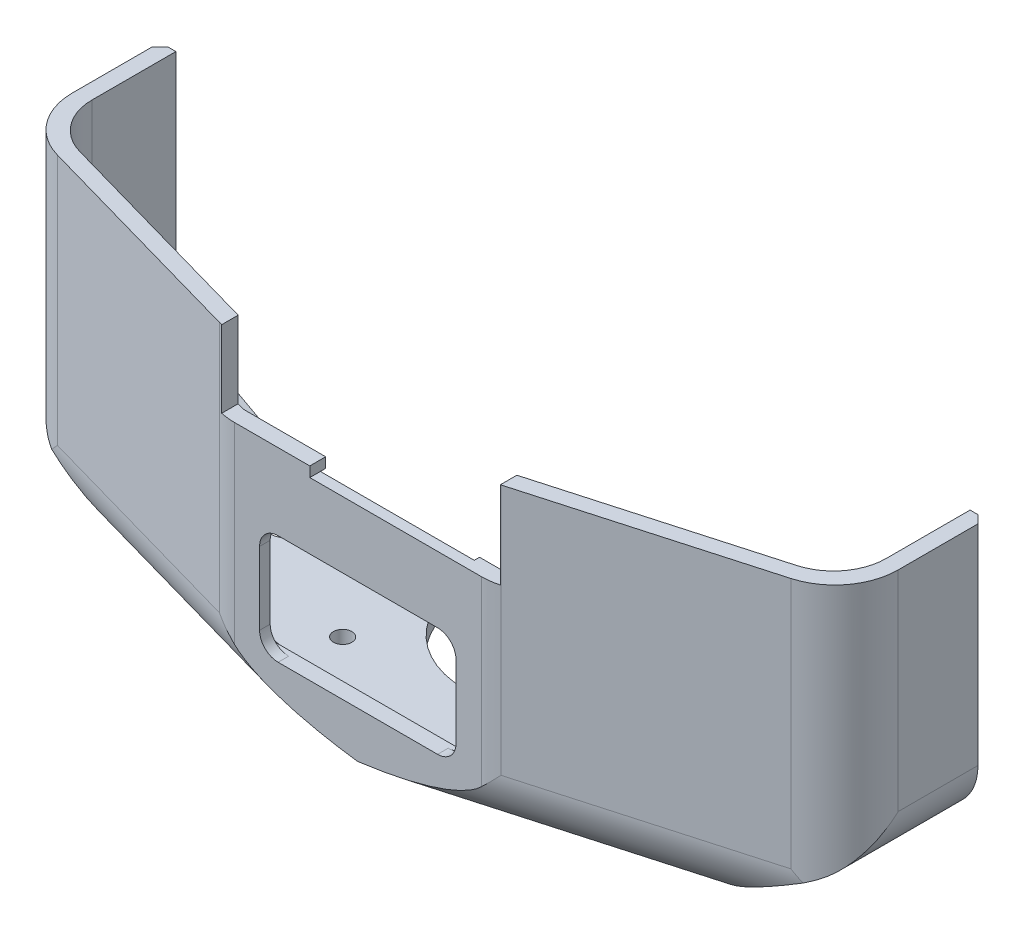
from build123d import *

# Parameters (mm, degrees)
BOSS_EXTRUDE1_DEPTH      = 30
BOSS_EXTRUDE1_DEPTH_BACK = 10.64
CUT_EXTRUDE1_DEPTH       = 103.587767302
SHELL1_T                 = -3
CUT_EXTRUDE4_DEPTH       = 4
CUT_EXTRUDE4_DEPTH_BACK  = 10
FILLET1_R                = 12
SKETCH4_R                = 1.75
CUT_EXTRUDE2_DEPTH       = 30
BOSS_EXTRUDE2_REACH      = 102.877
FILLET2_R                = 10
CUT_EXTRUDE5_DEPTH       = 3
CUT_EXTRUDE6_DEPTH       = 10
CUT_EXTRUDE8_REACH       = 99.307
SKETCH16_W               = 37.1
SKETCH16_H               = 20.7
FILLET3_SIZE             = 3.48
FILLET3_SIZE_2           = 3.5
CUT_EXTRUDE10_REACH      = 99.181
SKETCH17_W               = 40
SKETCH17_H               = 1
CUT_EXTRUDE13_DEPTH      = 10
CUT_EXTRUDE14_DEPTH      = 10
CHAMFER1_SIZE            = 1.5
SKETCH23_W               = 44.119126033
SKETCH23_H               = 4.214364277
BOSS_EXTRUDE3_DEPTH      = 3
CHAMFER2_START           = 18.419384615
CHAMFER2_DEPTH           = 4.277963528
CHAMFER2_START_2         = -21.42177789
CHAMFER2_2_DEPTH         = 2.918085582
CHAMFER2_3_DEPTH         = 44.119126033
CHAMFER2_START_3         = -18.503692308
CHAMFER2_4_DEPTH         = 3.433692208
CHAMFER2_START_4         = 15.0499999
CHAMFER2_5_DEPTH         = 3.369384715
CHAMFER2_START_5         = 27.133974371
CHAMFER2_6_DEPTH         = 0.866025629


with BuildPart() as part:
    # Sketch1 → Boss-Extrude1 (new, two sides: drawn at the far end of the back side and taken through both)
    with BuildSketch(Plane.XY.offset(-BOSS_EXTRUDE1_DEPTH_BACK)):
        Polygon((-52, -41.630628171), (52, -41.630628171), (78, -27.630628171), (78, 17.869371829), (-78, 17.869371829), (-78, -27.630628171), align=None)
    extrude(amount=BOSS_EXTRUDE1_DEPTH + BOSS_EXTRUDE1_DEPTH_BACK)

    # Sketch2 → Cut-Extrude1 (cut, through all)
    with BuildSketch(Plane(origin=(0, 17.869371829, 0), x_dir=(1, 0, 0), z_dir=(0, 1, 0))):
        Polygon((-78, -15), (-25, -30), (25, -30), (78, -15), (78, -44.649515781), (-78, -44.649515781), align=None)
    extrude(amount=-CUT_EXTRUDE1_DEPTH, mode=Mode.SUBTRACT)

    # Shell1
    shell1_openings = [part.faces().sort_by_distance(p)[0] for p in [
        (0, -10.856818648, -10.64),
    ]]
    offset(amount=SHELL1_T, openings=shell1_openings, kind=Kind.INTERSECTION)

    # Sketch7 → Cut-Extrude4 (cut, two sides: drawn at the far end of the back side and taken through both)
    with BuildSketch(Plane.XZ.offset(-14.869371829).offset(-CUT_EXTRUDE4_DEPTH_BACK)):
        with BuildLine():
            Line((-24.34, 27.068957127), (24.34, 27.068957127))
            Line((24.34, 27.068957127), (67.723224658, 14.790685998))
            ThreePointArc((67.723224658, 14.790685998), (72.97597162, 11.200530439), (75, 5.16862554))
            Line((75, 5.16862554), (75, -10.64))
            Line((75, -10.64), (-75, -10.64))
            Line((-75, -10.64), (-75, 5.168629683))
            ThreePointArc((-75, 5.168629683), (-72.975970371, 11.200532091), (-67.723224658, 14.790685998))
            Line((-67.723224658, 14.790685998), (-24.34, 27.068957127))
        make_face()
    extrude(amount=CUT_EXTRUDE4_DEPTH + CUT_EXTRUDE4_DEPTH_BACK, mode=Mode.SUBTRACT)

    # Fillet1
    # the kernel refuses this fillet: 12 mm, written as the material it adds along each edge
    with BuildSketch(Plane(origin=(-80.109828635, -38.630628171, 11.285043363), x_dir=(0.2723224657993489, 0, -0.9622060458243662), z_dir=(0.9622060458243663, 0, 0.27232246579934893))) as fillet1_piece_1_section:
        with BuildLine():
            CenterArc((FILLET1_R, FILLET1_R), FILLET1_R, 180, 90)
            Line((0, FILLET1_R), (0, 0))
            Line((0, 0), (FILLET1_R, 0))
        make_face()
    fillet1_piece_1 = extrude(amount=108.707161952, mode=Mode.PRIVATE)
    fillet1_piece_1 = split(fillet1_piece_1, bisect_by=Plane(origin=(-73.621558509, -26.580983653, 11.285043363), z_dir=(0.47409982303501746, 0.8804710999221753, 0)), keep=Keep.TOP, mode=Mode.PRIVATE)
    fillet1_piece_1 = split(fillet1_piece_1, bisect_by=Plane(origin=(-80.109828635, -38.630628171, 27), z_dir=(0, 0, -1)), keep=Keep.TOP, mode=Mode.PRIVATE)
    add(fillet1_piece_1)
    with BuildSketch(Plane(origin=(-24.48885982, -38.630628171, 40.888445756), x_dir=(-0.272322465799349, 0, -0.9622060458243663), z_dir=(0.9622060458243663, 0, -0.27232246579934893))) as fillet1_piece_2_section:
        with BuildLine():
            CenterArc((FILLET1_R, FILLET1_R), FILLET1_R, 180, 90)
            Line((0, FILLET1_R), (0, 0))
            Line((0, 0), (FILLET1_R, 0))
        make_face()
    fillet1_piece_2 = extrude(amount=108.707161952, mode=Mode.PRIVATE)
    fillet1_piece_2 = split(fillet1_piece_2, bisect_by=Plane(origin=(-7.466415568, -70.243738925, 40.888445756), z_dir=(-0.47409982303501746, 0.8804710999221753, 0)), keep=Keep.TOP, mode=Mode.PRIVATE)
    fillet1_piece_2 = split(fillet1_piece_2, bisect_by=Plane(origin=(-24.48885982, -38.630628171, 27), z_dir=(0, 0, -1)), keep=Keep.TOP, mode=Mode.PRIVATE)
    add(fillet1_piece_2)
    # the kernel refuses this fillet: 12 mm, written as the material it takes off along each edge
    with BuildSketch(Plane(origin=(-78, 40.557159045, 15), x_dir=(0.9622060458243661, 0, 0.2723224657993495), z_dir=(0, -1, 0))) as fillet1_2_piece_1:
        with BuildLine():
            CenterArc((FILLET1_R * 0.756259573881, -FILLET1_R), FILLET1_R, 90, 74.197486046)
            Line((-FILLET1_R * 0.205946471944, -FILLET1_R * 0.727677534201), (0, 0))
            Line((0, 0), (FILLET1_R * 0.756259573881, 0))
        make_face()
    extrude(amount=90.875574433, mode=Mode.SUBTRACT)
    with BuildSketch(Plane(origin=(-80.866181375, -41.630628171, 14.188816592), x_dir=(0.2723224657993489, 0, -0.9622060458243662), z_dir=(0.9622060458243663, 0, 0.27232246579934893)), Plane(origin=(-24.072508337, -41.630628171, 43.888445756), x_dir=(-0.2723224657993489, 0, -0.9622060458243662), z_dir=(0.9622060458243663, 0, -0.27232246579934893))) as fillet1_2_piece_2:
        with BuildLine():
            CenterArc((FILLET1_R, FILLET1_R), FILLET1_R, 180, 90)
            Line((0, FILLET1_R), (0, 0))
            Line((0, 0), (FILLET1_R, 0))
        make_face()
    extrude(amount=109.060517929, mode=Mode.SUBTRACT)
    with BuildSketch(Plane(origin=(-25, 22.03288666, 30), x_dir=(1, 0, 0), z_dir=(0, -1, 0)), Plane(origin=(25, 22.03288666, 30), x_dir=(0.9622060458243658, 0, -0.27232246579935065), z_dir=(0, -1, 0))) as fillet1_2_piece_3:
        with BuildLine():
            CenterArc((FILLET1_R * 0.138783827712, -FILLET1_R), FILLET1_R, 90, 15.802513954)
            Line((-FILLET1_R * 0.133538638087, -FILLET1_R * 0.0377939541756), (0, 0))
            Line((0, 0), (FILLET1_R * 0.138783827712, 0))
        make_face()
    extrude(amount=67.827029663, mode=Mode.SUBTRACT)
    with BuildSketch(Plane(origin=(78, 40.557159045, 15), x_dir=(-0.9622060458243661, 0, 0.2723224657993495), z_dir=(0, -1, 0))) as fillet1_2_piece_4:
        with BuildLine():
            CenterArc((FILLET1_R * 0.756259573881, FILLET1_R), FILLET1_R, 195.802513954, 74.197486046)
            Line((-FILLET1_R * 0.205946471944, FILLET1_R * 0.727677534201), (0, 0))
            Line((0, 0), (FILLET1_R * 0.756259573881, 0))
        make_face()
    extrude(amount=90.875574433, mode=Mode.SUBTRACT)

    # Sketch4 → Cut-Extrude2 (cut)
    with BuildSketch(Plane(origin=(0, -38.630628171, 0), x_dir=(1, 0, 0), z_dir=(0, 1, 0))):
        with Locations(Location((-20, -12.86, 0), (0, 0, 270))):
            Circle(SKETCH4_R)
        with Locations(Location((20, -12.86, 0), (0, 0, 270))):
            Circle(SKETCH4_R)
    extrude(amount=-CUT_EXTRUDE2_DEPTH, mode=Mode.SUBTRACT)

    # Sketch18 → Boss-Extrude2 (add, up to next)
    with BuildSketch(Plane.XZ.offset(-14.869371829), mode=Mode.PRIVATE) as boss_extrude2_sk1:
        with BuildLine():
            Line((75, 5.16862554), (75, 12.731221278))
            Line((75, 12.731221278), (67.723224658, 14.790685998))
            ThreePointArc((67.723224658, 14.790685998), (72.97597162, 11.200530439), (75, 5.16862554))
        make_face()
    boss_extrude2_tool1 = extrude(boss_extrude2_sk1.sketch, amount=BOSS_EXTRUDE2_REACH, mode=Mode.PRIVATE) - part.part
    # Sketch18 → Boss-Extrude2 (add, up to next)
    with BuildSketch(Plane.XZ.offset(-14.869371829), mode=Mode.PRIVATE) as boss_extrude2_sk2:
        with BuildLine():
            Line((-67.723224658, 14.790685998), (-75, 12.731221278))
            Line((-75, 12.731221278), (-75, 5.168629683))
            ThreePointArc((-75, 5.168629683), (-72.975970371, 11.200532091), (-67.723224658, 14.790685998))
        make_face()
    boss_extrude2_tool2 = extrude(boss_extrude2_sk2.sketch, amount=BOSS_EXTRUDE2_REACH, mode=Mode.PRIVATE) - part.part
    add(boss_extrude2_tool1.solids().sort_by_distance((73.432804, 14.869372, 11.546014))[0])
    add(boss_extrude2_tool2.solids().sort_by_distance((-73.432804, 14.869372, 11.546014))[0])

    # Fillet2
    # the kernel refuses this fillet: 10 mm, written as the material it takes off along each edge
    with BuildSketch(Plane(origin=(-78, -27.630628171, 20.857237152), x_dir=(0.8804710999221755, -0.474099823035017, 0), z_dir=(0, 0, -1)), Plane(origin=(78, -27.630628171, -25.572352039), x_dir=(-0.880471099922175, -0.474099823035018, 0), z_dir=(0, 0, 1))) as fillet2_piece_1:
        with BuildLine():
            CenterArc((FILLET2_R * 0.597294081556, -FILLET2_R), FILLET2_R, 90, 61.699244234)
            Line((-FILLET2_R * 0.283177018366, -FILLET2_R * 0.525900176965), (0, 0))
            Line((0, 0), (FILLET2_R * 0.597294081556, 0))
        make_face()
    extrude(amount=46.429589191, mode=Mode.SUBTRACT)
    with BuildSketch(Plane(origin=(-52, -41.630628171, 16.190088765), x_dir=(1, 0, 0), z_dir=(0, 0, -1))) as fillet2_piece_2:
        with BuildLine():
            CenterArc((FILLET2_R * 0.252117580033, -FILLET2_R), FILLET2_R, 90, 28.300755766)
            Line((-FILLET2_R * 0.221982243002, -FILLET2_R * 0.119528900078), (0, 0))
            Line((0, 0), (FILLET2_R * 0.252117580033, 0))
        make_face()
    extrude(amount=33.133028266, mode=Mode.SUBTRACT)
    with BuildSketch(Plane(origin=(52, -41.630628171, -16.942939501), x_dir=(0.8804710999221746, 0.47409982303501863, 0), z_dir=(0, 0, 1))) as fillet2_piece_3:
        with BuildLine():
            CenterArc((FILLET2_R * 0.252117580033, FILLET2_R), FILLET2_R, 241.699244234, 28.300755766)
            Line((-FILLET2_R * 0.221982243002, FILLET2_R * 0.119528900078), (0, 0))
            Line((0, 0), (FILLET2_R * 0.252117580033, 0))
        make_face()
    extrude(amount=33.133028266, mode=Mode.SUBTRACT)

    # Sketch12 → Cut-Extrude5 (cut)
    with BuildSketch(Plane.XZ.offset(41.630628171)):
        with BuildLine():
            Line((17.136070156, -11.190366124), (-17.136070156, -11.190366124))
            ThreePointArc((-17.136070156, -11.190366124), (0, 9.86), (17.136070156, -11.190366124))
        make_face()
    extrude(amount=-CUT_EXTRUDE5_DEPTH, mode=Mode.SUBTRACT)

    # Sketch13 → Cut-Extrude6 (cut)
    with BuildSketch(Plane.XY.offset(30)):
        Polygon((26.5, 17.869371829), (26.5, 1.469371829), (-9.07, 1.469371829), (-9.07, 3.373687247), (-26, 3.373687247), (-26, 17.869371829), (0, 17.869371829), align=None)
    extrude(amount=-CUT_EXTRUDE6_DEPTH, mode=Mode.SUBTRACT)

    # Sketch16 → Cut-Extrude8 (cut, up to next)
    with BuildSketch(Plane.XY.offset(30), mode=Mode.PRIVATE) as cut_extrude8_sk1:
        with Locations((0, -21.380628171)):
            Rectangle(SKETCH16_W, SKETCH16_H)
    cut_extrude8_tool1 = extrude(cut_extrude8_sk1.sketch, amount=-CUT_EXTRUDE8_REACH, mode=Mode.PRIVATE) & part.part
    add(cut_extrude8_tool1.solids().sort_by_distance((0, -21.380628, 30))[0], mode=Mode.SUBTRACT)

    # Fillet3
    # a fillet whose section is not a circle: 3.5, 3.48 mm, written as the material it adds along each edge
    with BuildSketch(Plane(origin=(-18.55, -11.030628171, 30), x_dir=(1, 0, 0), z_dir=(0, 0, -1)), Plane(origin=(18.55, -31.730628171, 30), x_dir=(-1, 0, 0), z_dir=(0, 0, -1)), Plane(origin=(18.55, -11.030628171, 30), x_dir=(0, -1, 0), z_dir=(0, 0, -1))) as fillet3_piece_1:
        with BuildLine():
            Bezier((FILLET3_SIZE, 0), (0, 0), (0, FILLET3_SIZE_2), weights=[1, 0.707106781, 1])
            Line((0, FILLET3_SIZE_2), (0, 0))
            Line((0, 0), (FILLET3_SIZE, 0))
        make_face()
    extrude(amount=3)
    with BuildSketch(Plane(origin=(-18.55, -31.730628171, 30), x_dir=(1, 0, 0), z_dir=(0, 0, -1))) as fillet3_piece_2:
        with BuildLine():
            Bezier((FILLET3_SIZE_2, 0), (0, 0), (0, -FILLET3_SIZE), weights=[1, 0.707106781, 1])
            Line((0, -FILLET3_SIZE), (0, 0))
            Line((0, 0), (FILLET3_SIZE_2, 0))
        make_face()
    extrude(amount=3)

    # Cut-Extrude10: up to this face of the body (flat: up to its plane)
    cut_extrude10_end = Plane(part.part.faces().sort_by_distance((8.72757923, 1.469371829, 28.486096121))[0])
    # Sketch17 → Cut-Extrude10 (cut, up to the picked face)
    with BuildSketch(Plane(origin=(0, -31.730628171, 0), x_dir=(1, 0, 0), z_dir=(0, 1, 0)), mode=Mode.PRIVATE) as cut_extrude10_sk1:
        with Locations((0, -27.5)):
            Rectangle(SKETCH17_W, SKETCH17_H)
    cut_extrude10_tool1 = split(extrude(cut_extrude10_sk1.sketch, amount=CUT_EXTRUDE10_REACH, mode=Mode.PRIVATE), bisect_by=cut_extrude10_end, keep=Keep.BOTH, mode=Mode.PRIVATE)
    add(cut_extrude10_tool1.solids().sort_by(Axis((0, -31.730628, 27.5), (0, 1, 0)))[0], mode=Mode.SUBTRACT)

    # Sketch21 → Cut-Extrude13 (cut)
    with BuildSketch(Plane(origin=(0, -38.630628171, 0), x_dir=(1, 0, 0), z_dir=(0, 1, 0))):
        Polygon((-52.847471347, 10.64), (-52.847471347, -8.779599872), (-33.425901117, -22.286136195), (33.425901117, -22.286136195), (52.847471347, -7.124409239), (52.847471347, 10.64), align=None)
    extrude(amount=CUT_EXTRUDE13_DEPTH, mode=Mode.SUBTRACT)

    # Sketch22 → Cut-Extrude14 (cut)
    with BuildSketch(Plane.XZ.offset(41.630628171)):
        with BuildLine():
            Line((-40.25, -10.64), (-40.25, -0.64))
            ThreePointArc((-40.25, -0.64), (-43.75, 2.86), (-47.25, -0.64))
            Line((-47.25, -0.64), (-47.25, -10.64))
            Line((-47.25, -10.64), (-40.25, -10.64))
        make_face()
        with BuildLine():
            Line((47.25, -10.64), (47.25, -0.64))
            ThreePointArc((47.25, -0.64), (43.75, 2.86), (40.25, -0.64))
            Line((40.25, -0.64), (40.25, -10.64))
            Line((40.25, -10.64), (47.25, -10.64))
        make_face()
    extrude(amount=-CUT_EXTRUDE14_DEPTH, mode=Mode.SUBTRACT)

    # Chamfer1
    chamfer1_edges = [part.edges().sort_by_distance(p)[0] for p in [
        (-63.48041033, -35.448868763, -10.64),
        (78, -1.894157764, -10.64),
        (63.48041033, -35.448868763, -10.64),
        (-48.3644121, -41.630628171, -10.64),
        (76.585161102, -26.785553271, -10.64),
        (51.923501071, -41.327202566, -10.64),
        (-51.923501071, -41.327202566, -10.64),
        (-76.585161102, -26.785553271, -10.64),
        (28.745469825, -41.630628171, -10.64),
        (-78, -1.894157764, -10.64),
        (48.3644121, -41.630628171, -10.64),
        (-28.745469825, -41.630628171, -10.64),
    ]]
    chamfer(chamfer1_edges, length=CHAMFER1_SIZE)

    # Sketch23 → Boss-Extrude3 (add)
    with BuildSketch(Plane(origin=(0, 0, 28), x_dir=(-1, 0, 0), z_dir=(0, 0, -1))):
        with Locations((-0.637785127, -7.423446033)):
            Rectangle(SKETCH23_W, SKETCH23_H)
    extrude(amount=BOSS_EXTRUDE3_DEPTH)

    # Chamfer2: read off the stored shape, not the designer's step
    # Chamfer2 outline → Chamfer2 (add)
    with BuildSketch(Plane.YZ.offset(CHAMFER2_START)):
        Polygon((-11.530628171, 28), (-11.030628171, 27.133974596), (-11.030628171, 28), align=None)
    extrude(amount=CHAMFER2_DEPTH)

    # Chamfer2 2 outline → Chamfer2 2 (add)
    with BuildSketch(Plane.YZ.offset(CHAMFER2_START_2)):
        Polygon((-11.530628171, 28), (-11.030628171, 27.133974596), (-11.030628171, 28), align=None)
    extrude(amount=CHAMFER2_2_DEPTH)

    # Chamfer2 3 outline → Chamfer2 3 (add)
    with BuildSketch(Plane.YZ.offset(CHAMFER2_START_2)):
        Polygon((-11.030628171, 28), (-11.030628171, 27.133974596), (-9.798577364, 25), (-9.530628171, 25), (-9.530628171, 28), align=None)
    extrude(amount=CHAMFER2_3_DEPTH)

    # Chamfer2 4 outline → Chamfer2 4 (add)
    with BuildSketch(Plane.YZ.offset(CHAMFER2_START_3)):
        Polygon((-11.530628171, 28), (-11.030628171, 27.133974596), (-11.030628171, 28), align=None)
    extrude(amount=CHAMFER2_4_DEPTH)

    # Chamfer2 5 outline → Chamfer2 5 (add)
    with BuildSketch(Plane.YZ.offset(CHAMFER2_START_4)):
        Polygon((-11.530628171, 28), (-11.030628171, 27.133974596), (-11.030628171, 28), align=None)
    extrude(amount=CHAMFER2_5_DEPTH)

    # Chamfer2 6 outline → Chamfer2 6 (cut)
    with BuildSketch(Plane.XY.offset(CHAMFER2_START_5)):
        with BuildLine():
            Line((-15.0700001, -13), (-15.07, -11.030628171))
            add(Edge.make_bspline(
                [(-15.07, -11.030628171), (-16.973154412, -11.030628171), (-18, -12.642205699)],
                knots=[0, 0, 0, 0.630569309, 0.630569309, 0.630569309], degree=2, weights=[1, 0.815310525, 0.86354008]))
            Line((-18, -12.642205699), (-18, -13))
            Line((-18, -13), (-15.0700001, -13))
        make_face()
        with BuildLine():
            Line((15.05, -11.030628171), (15.0499999, -13))
            Line((15.0499999, -13), (18, -13))
            Line((18, -13), (18, -12.637910099))
            add(Edge.make_bspline(
                [(18, -12.637910099), (16.967904112, -11.030628171), (15.05, -11.030628171)],
                knots=[0.368407187, 0.368407187, 0.368407187, 1, 1, 1], degree=2, weights=[0.86369726, 0.815010748, 1]))
        make_face()
    extrude(amount=CHAMFER2_6_DEPTH, mode=Mode.SUBTRACT)


solid = part.part
